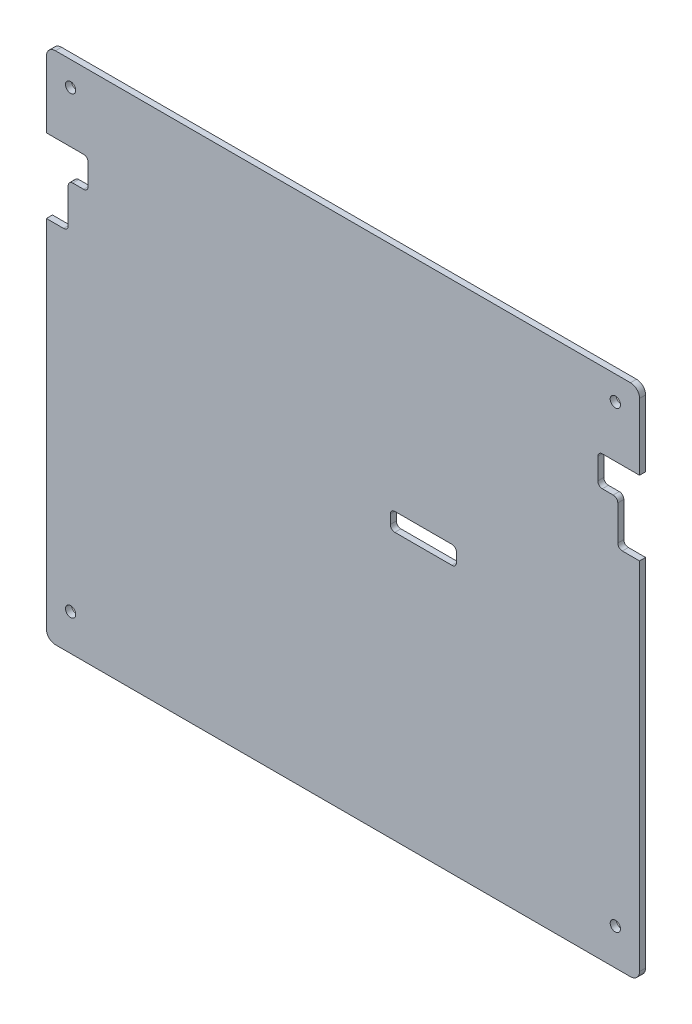
from build123d import *

# Parameters (mm, degrees)
ACRYLIC_2MM_START       = -12
ACRYLIC_2MM_DEPTH       = 2
HINGE_CLEARANCE_0_START = -9.8
HINGE_CLEARANCE_0_DEPTH = 2.4
HINGE_CLEARANCE_1_START = -9.8
HINGE_CLEARANCE_1_DEPTH = 2.4
M3_CLEARANCE_0_START    = -9.8
SKETCH_30_R             = 1.7
M3_CLEARANCE_0_DEPTH    = 2.4
M3_CLEARANCE_1_START    = -9.8
SKETCH_31_R             = 1.7
M3_CLEARANCE_1_DEPTH    = 2.4
M3_CLEARANCE_2_START    = -9.8
SKETCH_32_R             = 1.7
M3_CLEARANCE_2_DEPTH    = 2.4
M3_CLEARANCE_3_START    = -9.8
SKETCH_33_R             = 1.7
M3_CLEARANCE_3_DEPTH    = 2.4
KEYS_ACCESS_R1_5_START  = -9.8
KEYS_ACCESS_R1_5_DEPTH  = 2.4


with BuildPart() as part:
    # Acrylic_2mm_profile → Acrylic_2mm (new body)
    with BuildSketch(Plane.XY.offset(ACRYLIC_2MM_START)):
        with BuildLine():
            Line((0, -7), (190, -7))
            ThreePointArc((190, -7), (192.121320344, -6.121320344), (193, -4))
            Line((193, -4), (193, 160))
            ThreePointArc((193, 160), (192.121320344, 162.121320344), (190, 163))
            Line((190, 163), (0, 163))
            ThreePointArc((0, 163), (-2.121320344, 162.121320344), (-3, 160))
            Line((-3, 160), (-3, -4))
            ThreePointArc((-3, -4), (-2.121320344, -6.121320344), (0, -7))
        make_face()
    extrude(amount=ACRYLIC_2MM_DEPTH)

    # Эскиз28 → Hinge_clearance_0 (cut)
    with BuildSketch(Plane.XY.offset(HINGE_CLEARANCE_0_START)):
        with BuildLine():
            Line((-4.5, 113.5), (2.7, 113.5))
            ThreePointArc((2.7, 113.5), (3.760660172, 113.939339828), (4.2, 115))
            Line((4.2, 115), (4.2, 126.5))
            ThreePointArc((4.2, 126.5), (4.639339828, 127.560660172), (5.7, 128))
            Line((5.7, 128), (9.3, 128))
            ThreePointArc((9.3, 128), (10.360660172, 128.439339828), (10.8, 129.5))
            Line((10.8, 129.5), (10.8, 136.5))
            ThreePointArc((10.8, 136.5), (10.360660172, 137.560660172), (9.3, 138))
            Line((9.3, 138), (-4.5, 138))
            ThreePointArc((-4.5, 138), (-5.560660172, 137.560660172), (-6, 136.5))
            Line((-6, 136.5), (-6, 115))
            ThreePointArc((-6, 115), (-5.560660172, 113.939339828), (-4.5, 113.5))
        make_face()
    extrude(amount=-HINGE_CLEARANCE_0_DEPTH, mode=Mode.SUBTRACT)

    # Эскиз29 → Hinge_clearance_1 (cut)
    with BuildSketch(Plane.XY.offset(HINGE_CLEARANCE_1_START)):
        with BuildLine():
            Line((194.5, 113.5), (187.3, 113.5))
            ThreePointArc((187.3, 113.5), (186.239339828, 113.939339828), (185.8, 115))
            Line((185.8, 115), (185.8, 126.5))
            ThreePointArc((185.8, 126.5), (185.360660172, 127.560660172), (184.3, 128))
            Line((184.3, 128), (180.7, 128))
            ThreePointArc((180.7, 128), (179.639339828, 128.439339828), (179.2, 129.5))
            Line((179.2, 129.5), (179.2, 136.5))
            ThreePointArc((179.2, 136.5), (179.639339828, 137.560660172), (180.7, 138))
            Line((180.7, 138), (194.5, 138))
            ThreePointArc((194.5, 138), (195.560660172, 137.560660172), (196, 136.5))
            Line((196, 136.5), (196, 115))
            ThreePointArc((196, 115), (195.560660172, 113.939339828), (194.5, 113.5))
        make_face()
    extrude(amount=-HINGE_CLEARANCE_1_DEPTH, mode=Mode.SUBTRACT)

    # Эскиз30 → M3_clearance_0 (cut)
    with BuildSketch(Plane.XY.offset(M3_CLEARANCE_0_START)):
        with Locations((5, 5)):
            Circle(SKETCH_30_R)
    extrude(amount=-M3_CLEARANCE_0_DEPTH, mode=Mode.SUBTRACT)

    # Эскиз31 → M3_clearance_1 (cut)
    with BuildSketch(Plane.XY.offset(M3_CLEARANCE_1_START)):
        with Locations((185, 5)):
            Circle(SKETCH_31_R)
    extrude(amount=-M3_CLEARANCE_1_DEPTH, mode=Mode.SUBTRACT)

    # Эскиз32 → M3_clearance_2 (cut)
    with BuildSketch(Plane.XY.offset(M3_CLEARANCE_2_START)):
        with Locations((5, 155)):
            Circle(SKETCH_32_R)
    extrude(amount=-M3_CLEARANCE_2_DEPTH, mode=Mode.SUBTRACT)

    # Эскиз33 → M3_clearance_3 (cut)
    with BuildSketch(Plane.XY.offset(M3_CLEARANCE_3_START)):
        with Locations((185, 155)):
            Circle(SKETCH_33_R)
    extrude(amount=-M3_CLEARANCE_3_DEPTH, mode=Mode.SUBTRACT)

    # Эскиз34 → Keys_access_R1_5 (cut)
    with BuildSketch(Plane.XY.offset(KEYS_ACCESS_R1_5_START)):
        with BuildLine():
            Line((112.12500058, 81.24999704), (130.9999982, 81.24999704))
            ThreePointArc((130.9999982, 81.24999704), (132.060658372, 81.689336868), (132.4999982, 82.74999704))
            Line((132.4999982, 82.74999704), (132.4999982, 85.74999974))
            ThreePointArc((132.4999982, 85.74999974), (132.060658372, 86.810659912), (130.9999982, 87.24999974))
            Line((130.9999982, 87.24999974), (112.12500058, 87.24999974))
            ThreePointArc((112.12500058, 87.24999974), (111.064340408, 86.810659912), (110.62500058, 85.74999974))
            Line((110.62500058, 85.74999974), (110.62500058, 82.74999704))
            ThreePointArc((110.62500058, 82.74999704), (111.064340408, 81.689336868), (112.12500058, 81.24999704))
        make_face()
    extrude(amount=-KEYS_ACCESS_R1_5_DEPTH, mode=Mode.SUBTRACT)


solid = part.part
